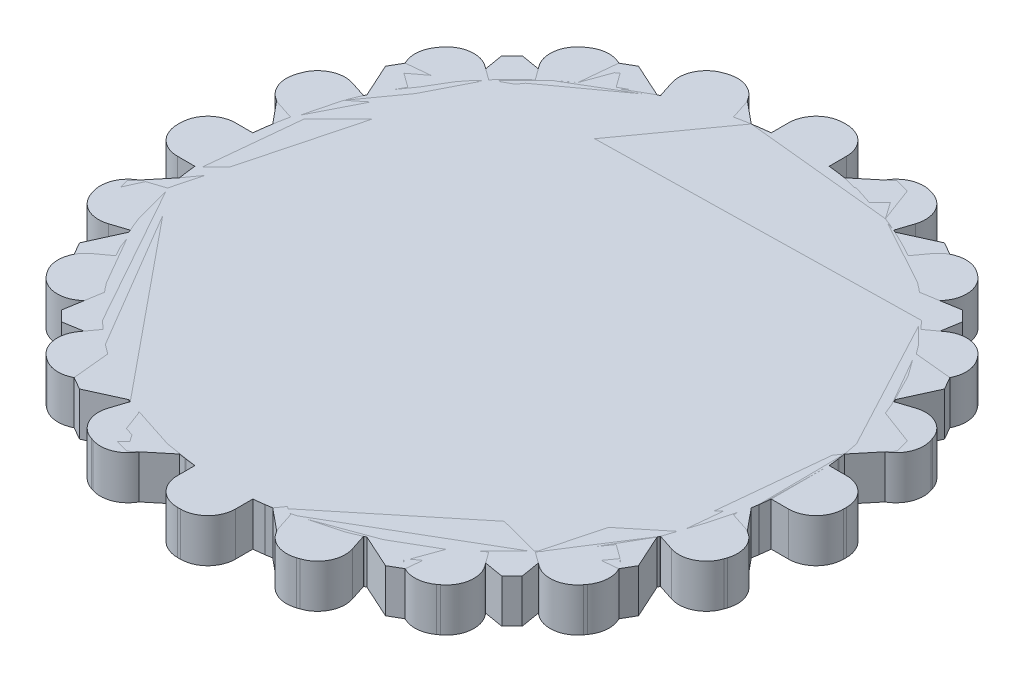
from build123d import *

# Parameters (mm, degrees)
BOSS_EXTRUDE3_DEPTH = 3
BOSS_EXTRUDE5_DEPTH = 3
BOSS_EXTRUDE6_DEPTH = 3


with BuildPart() as part:
    # Sketch2 → Boss-Extrude3 (new body)
    with BuildSketch(Plane(origin=(0, 0, 0), x_dir=(1, 0, 0), z_dir=(0, 1, 0))):
        with BuildLine():
            Line((-23, 0.1), (-23, -0.1))
            ThreePointArc((-23, -0.1), (-22.443502884, -1.443502884), (-21.1, -2))
            Line((-21.1, -2), (-19.899748742, -2))
            ThreePointArc((-19.899748742, -2), (-19.753766812, -3.128689301), (-19.543819703, -4.247247513))
            Line((-19.543819703, -4.247247513), (-20.685326483, -4.618145549))
            ThreePointArc((-20.685326483, -4.618145549), (-21.791106589, -5.56257098), (-21.905201574, -7.012285219))
            Line((-21.905201574, -7.012285219), (-21.843398175, -7.202496522))
            ThreePointArc((-21.843398175, -7.202496522), (-20.898972744, -8.308276629), (-19.449258505, -8.422371614))
            Line((-19.449258505, -8.422371614), (-18.307751725, -8.051473578))
            ThreePointArc((-18.307751725, -8.051473578), (-17.820130484, -9.079809995), (-17.274805421, -10.078744846))
            Line((-17.274805421, -10.078744846), (-18.245829086, -10.784234835))
            ThreePointArc((-18.245829086, -10.784234835), (-19.005644954, -12.02414164), (-18.666169396, -13.438159103))
            Line((-18.666169396, -13.438159103), (-18.548612345, -13.599962502))
            ThreePointArc((-18.548612345, -13.599962502), (-17.30870554, -14.35977837), (-15.894688077, -14.020302812))
            Line((-15.894688077, -14.020302812), (-14.923664412, -13.314812824))
            ThreePointArc((-14.923664412, -13.314812824), (-14.142135624, -14.142135624), (-13.314812824, -14.923664412))
            Line((-13.314812824, -14.923664412), (-14.020302812, -15.894688077))
            ThreePointArc((-14.020302812, -15.894688077), (-14.35977837, -17.30870554), (-13.599962502, -18.548612345))
            Line((-13.599962502, -18.548612345), (-13.438159103, -18.666169396))
            ThreePointArc((-13.438159103, -18.666169396), (-12.02414164, -19.005644954), (-10.784234835, -18.245829086))
            Line((-10.784234835, -18.245829086), (-10.078744846, -17.274805421))
            ThreePointArc((-10.078744846, -17.274805421), (-9.079809995, -17.820130484), (-8.051473578, -18.307751725))
            Line((-8.051473578, -18.307751725), (-8.422371614, -19.449258505))
            ThreePointArc((-8.422371614, -19.449258505), (-8.308276629, -20.898972744), (-7.202496522, -21.843398175))
            Line((-7.202496522, -21.843398175), (-7.012285219, -21.905201574))
            ThreePointArc((-7.012285219, -21.905201574), (-5.56257098, -21.791106589), (-4.618145549, -20.685326483))
            Line((-4.618145549, -20.685326483), (-4.247247513, -19.543819703))
            ThreePointArc((-4.247247513, -19.543819703), (-3.128689301, -19.753766812), (-2, -19.899748742))
            Line((-2, -19.899748742), (-2, -21.1))
            ThreePointArc((-2, -21.1), (-1.443502884, -22.443502884), (-0.1, -23))
            Line((-0.1, -23), (0.1, -23))
            ThreePointArc((0.1, -23), (1.443502884, -22.443502884), (2, -21.1))
            Line((2, -21.1), (2, -19.899748742))
            ThreePointArc((2, -19.899748742), (3.128689301, -19.753766812), (4.247247513, -19.543819703))
            Line((4.247247513, -19.543819703), (4.618145549, -20.685326483))
            ThreePointArc((4.618145549, -20.685326483), (5.56257098, -21.791106589), (7.012285219, -21.905201574))
            Line((7.012285219, -21.905201574), (7.202496522, -21.843398175))
            ThreePointArc((7.202496522, -21.843398175), (8.308276629, -20.898972744), (8.422371614, -19.449258505))
            Line((8.422371614, -19.449258505), (8.051473578, -18.307751725))
            ThreePointArc((8.051473578, -18.307751725), (9.079809995, -17.820130484), (10.078744846, -17.274805421))
            Line((10.078744846, -17.274805421), (10.784234835, -18.245829086))
            ThreePointArc((10.784234835, -18.245829086), (12.02414164, -19.005644954), (13.438159103, -18.666169396))
            Line((13.438159103, -18.666169396), (13.599962502, -18.548612345))
            ThreePointArc((13.599962502, -18.548612345), (14.35977837, -17.30870554), (14.020302812, -15.894688077))
            Line((14.020302812, -15.894688077), (13.314812824, -14.923664412))
            ThreePointArc((13.314812824, -14.923664412), (14.142135624, -14.142135624), (14.923664412, -13.314812824))
            Line((14.923664412, -13.314812824), (15.894688077, -14.020302812))
            ThreePointArc((15.894688077, -14.020302812), (17.30870554, -14.35977837), (18.548612345, -13.599962502))
            Line((18.548612345, -13.599962502), (18.666169396, -13.438159103))
            ThreePointArc((18.666169396, -13.438159103), (19.005644954, -12.02414164), (18.245829086, -10.784234835))
            Line((18.245829086, -10.784234835), (17.274805421, -10.078744846))
            ThreePointArc((17.274805421, -10.078744846), (17.820130484, -9.079809995), (18.307751725, -8.051473578))
            Line((18.307751725, -8.051473578), (19.449258505, -8.422371614))
            ThreePointArc((19.449258505, -8.422371614), (20.898972744, -8.308276629), (21.843398175, -7.202496522))
            Line((21.843398175, -7.202496522), (21.905201574, -7.012285219))
            ThreePointArc((21.905201574, -7.012285219), (21.791106589, -5.56257098), (20.685326483, -4.618145549))
            Line((20.685326483, -4.618145549), (19.543819703, -4.247247513))
            ThreePointArc((19.543819703, -4.247247513), (19.753766812, -3.128689301), (19.899748742, -2))
            Line((19.899748742, -2), (21.1, -2))
            ThreePointArc((21.1, -2), (22.443502884, -1.443502884), (23, -0.1))
            Line((23, -0.1), (23, 0.1))
            ThreePointArc((23, 0.1), (22.443502884, 1.443502884), (21.1, 2))
            Line((21.1, 2), (19.899748742, 2))
            ThreePointArc((19.899748742, 2), (19.753766812, 3.128689301), (19.543819703, 4.247247513))
            Line((19.543819703, 4.247247513), (20.685326483, 4.618145549))
            ThreePointArc((20.685326483, 4.618145549), (21.791106589, 5.56257098), (21.905201574, 7.012285219))
            Line((21.905201574, 7.012285219), (21.843398175, 7.202496522))
            ThreePointArc((21.843398175, 7.202496522), (20.898972744, 8.308276629), (19.449258505, 8.422371614))
            Line((19.449258505, 8.422371614), (18.307751725, 8.051473578))
            ThreePointArc((18.307751725, 8.051473578), (17.820130484, 9.079809995), (17.274805421, 10.078744846))
            Line((17.274805421, 10.078744846), (18.245829086, 10.784234835))
            ThreePointArc((18.245829086, 10.784234835), (19.005644954, 12.02414164), (18.666169396, 13.438159103))
            Line((18.666169396, 13.438159103), (18.548612345, 13.599962502))
            ThreePointArc((18.548612345, 13.599962502), (17.30870554, 14.35977837), (15.894688077, 14.020302812))
            Line((15.894688077, 14.020302812), (14.923664412, 13.314812824))
            ThreePointArc((14.923664412, 13.314812824), (14.142135624, 14.142135624), (13.314812824, 14.923664412))
            Line((13.314812824, 14.923664412), (14.020302812, 15.894688077))
            ThreePointArc((14.020302812, 15.894688077), (14.35977837, 17.30870554), (13.599962502, 18.548612345))
            Line((13.599962502, 18.548612345), (13.438159103, 18.666169396))
            ThreePointArc((13.438159103, 18.666169396), (12.02414164, 19.005644954), (10.784234835, 18.245829086))
            Line((10.784234835, 18.245829086), (10.078744846, 17.274805421))
            ThreePointArc((10.078744846, 17.274805421), (9.079809995, 17.820130484), (8.051473578, 18.307751725))
            Line((8.051473578, 18.307751725), (8.422371614, 19.449258505))
            ThreePointArc((8.422371614, 19.449258505), (8.308276629, 20.898972744), (7.202496522, 21.843398175))
            Line((7.202496522, 21.843398175), (7.012285219, 21.905201574))
            ThreePointArc((7.012285219, 21.905201574), (5.56257098, 21.791106589), (4.618145549, 20.685326483))
            Line((4.618145549, 20.685326483), (4.247247513, 19.543819703))
            ThreePointArc((4.247247513, 19.543819703), (3.128689301, 19.753766812), (2, 19.899748742))
            Line((2, 19.899748742), (2, 21.1))
            ThreePointArc((2, 21.1), (1.443502884, 22.443502884), (0.1, 23))
            Line((0.1, 23), (-0.1, 23))
            ThreePointArc((-0.1, 23), (-1.443502884, 22.443502884), (-2, 21.1))
            Line((-2, 21.1), (-2, 19.899748742))
            ThreePointArc((-2, 19.899748742), (-3.128689301, 19.753766812), (-4.247247513, 19.543819703))
            Line((-4.247247513, 19.543819703), (-4.618145549, 20.685326483))
            ThreePointArc((-4.618145549, 20.685326483), (-5.56257098, 21.791106589), (-7.012285219, 21.905201574))
            Line((-7.012285219, 21.905201574), (-7.202496522, 21.843398175))
            ThreePointArc((-7.202496522, 21.843398175), (-8.308276629, 20.898972744), (-8.422371614, 19.449258505))
            Line((-8.422371614, 19.449258505), (-8.051473578, 18.307751725))
            ThreePointArc((-8.051473578, 18.307751725), (-9.079809995, 17.820130484), (-10.078744846, 17.274805421))
            Line((-10.078744846, 17.274805421), (-10.784234835, 18.245829086))
            ThreePointArc((-10.784234835, 18.245829086), (-12.02414164, 19.005644954), (-13.438159103, 18.666169396))
            Line((-13.438159103, 18.666169396), (-13.599962502, 18.548612345))
            ThreePointArc((-13.599962502, 18.548612345), (-14.35977837, 17.30870554), (-14.020302812, 15.894688077))
            Line((-14.020302812, 15.894688077), (-13.314812824, 14.923664412))
            ThreePointArc((-13.314812824, 14.923664412), (-14.142135624, 14.142135624), (-14.923664412, 13.314812824))
            Line((-14.923664412, 13.314812824), (-15.894688077, 14.020302812))
            ThreePointArc((-15.894688077, 14.020302812), (-17.30870554, 14.35977837), (-18.548612345, 13.599962502))
            Line((-18.548612345, 13.599962502), (-18.666169396, 13.438159103))
            ThreePointArc((-18.666169396, 13.438159103), (-19.005644954, 12.02414164), (-18.245829086, 10.784234835))
            Line((-18.245829086, 10.784234835), (-17.274805421, 10.078744846))
            ThreePointArc((-17.274805421, 10.078744846), (-17.820130484, 9.079809995), (-18.307751725, 8.051473578))
            Line((-18.307751725, 8.051473578), (-19.449258505, 8.422371614))
            ThreePointArc((-19.449258505, 8.422371614), (-20.898972744, 8.308276629), (-21.843398175, 7.202496522))
            Line((-21.843398175, 7.202496522), (-21.905201574, 7.012285219))
            ThreePointArc((-21.905201574, 7.012285219), (-21.791106589, 5.56257098), (-20.685326483, 4.618145549))
            Line((-20.685326483, 4.618145549), (-19.543819703, 4.247247513))
            ThreePointArc((-19.543819703, 4.247247513), (-19.753766812, 3.128689301), (-19.899748742, 2))
            Line((-19.899748742, 2), (-21.1, 2))
            ThreePointArc((-21.1, 2), (-22.443502884, 1.443502884), (-23, 0.1))
        make_face()
    extrude(amount=BOSS_EXTRUDE3_DEPTH)


with BuildPart() as body_2:
    # Sketch3 → Boss-Extrude5 (new body)
    with BuildSketch(Plane(origin=(0, 0, 0), x_dir=(1, 0, 0), z_dir=(0, 1, 0))):
        with BuildLine():
            Line((-22, 0.5), (-22, -0.5))
            Line((-22, -0.5), (-19.899748742, -2))
            ThreePointArc((-19.899748742, -2), (-19.828897227, -2.610523844), (-19.739319337, -3.218582315))
            Line((-19.739319337, -3.218582315), (-21.379777701, -5.211056079))
            Line((-21.379777701, -5.211056079), (-21.120958656, -6.176981905))
            Line((-21.120958656, -6.176981905), (-18.704043156, -7.08228562))
            ThreePointArc((-18.704043156, -7.08228562), (-18.47759065, -7.653668647), (-18.23368794, -8.217823563))
            Line((-18.23368794, -8.217823563), (-19.302558883, -10.566987298))
            Line((-19.302558883, -10.566987298), (-18.802558883, -11.433012702))
            Line((-18.802558883, -11.433012702), (-16.23368794, -11.681925179))
            ThreePointArc((-16.23368794, -11.681925179), (-15.867066806, -12.17522858), (-15.485460842, -12.657033717))
            Line((-15.485460842, -12.657033717), (-15.909902577, -15.202795796))
            Line((-15.909902577, -15.202795796), (-15.202795796, -15.909902577))
            Line((-15.202795796, -15.909902577), (-12.657033717, -15.485460842))
            ThreePointArc((-12.657033717, -15.485460842), (-12.17522858, -15.867066806), (-11.681925179, -16.23368794))
            Line((-11.681925179, -16.23368794), (-11.433012702, -18.802558883))
            Line((-11.433012702, -18.802558883), (-10.566987298, -19.302558883))
            Line((-10.566987298, -19.302558883), (-8.217823563, -18.23368794))
            ThreePointArc((-8.217823563, -18.23368794), (-7.653668647, -18.47759065), (-7.08228562, -18.704043156))
            Line((-7.08228562, -18.704043156), (-6.176981905, -21.120958656))
            Line((-6.176981905, -21.120958656), (-5.211056079, -21.379777701))
            Line((-5.211056079, -21.379777701), (-3.218582315, -19.739319337))
            ThreePointArc((-3.218582315, -19.739319337), (-2.610523844, -19.828897227), (-2, -19.899748742))
            Line((-2, -19.899748742), (-0.5, -22))
            Line((-0.5, -22), (0.5, -22))
            Line((0.5, -22), (2, -19.899748742))
            ThreePointArc((2, -19.899748742), (2.610523844, -19.828897227), (3.218582315, -19.739319337))
            Line((3.218582315, -19.739319337), (5.211056079, -21.379777701))
            Line((5.211056079, -21.379777701), (6.176981905, -21.120958656))
            Line((6.176981905, -21.120958656), (7.08228562, -18.704043156))
            ThreePointArc((7.08228562, -18.704043156), (7.653668647, -18.47759065), (8.217823563, -18.23368794))
            Line((8.217823563, -18.23368794), (10.566987298, -19.302558883))
            Line((10.566987298, -19.302558883), (11.433012702, -18.802558883))
            Line((11.433012702, -18.802558883), (11.681925179, -16.23368794))
            ThreePointArc((11.681925179, -16.23368794), (12.17522858, -15.867066806), (12.657033717, -15.485460842))
            Line((12.657033717, -15.485460842), (15.202795796, -15.909902577))
            Line((15.202795796, -15.909902577), (15.909902577, -15.202795796))
            Line((15.909902577, -15.202795796), (15.485460842, -12.657033717))
            ThreePointArc((15.485460842, -12.657033717), (15.867066806, -12.17522858), (16.23368794, -11.681925179))
            Line((16.23368794, -11.681925179), (18.802558883, -11.433012702))
            Line((18.802558883, -11.433012702), (19.302558883, -10.566987298))
            Line((19.302558883, -10.566987298), (18.23368794, -8.217823563))
            ThreePointArc((18.23368794, -8.217823563), (18.47759065, -7.653668647), (18.704043156, -7.08228562))
            Line((18.704043156, -7.08228562), (21.120958656, -6.176981905))
            Line((21.120958656, -6.176981905), (21.379777701, -5.211056079))
            Line((21.379777701, -5.211056079), (19.739319337, -3.218582315))
            ThreePointArc((19.739319337, -3.218582315), (19.828897227, -2.610523844), (19.899748742, -2))
            Line((19.899748742, -2), (22, -0.5))
            Line((22, -0.5), (22, 0.5))
            Line((22, 0.5), (19.899748742, 2))
            ThreePointArc((19.899748742, 2), (19.828897227, 2.610523844), (19.739319337, 3.218582315))
            Line((19.739319337, 3.218582315), (21.379777701, 5.211056079))
            Line((21.379777701, 5.211056079), (21.120958656, 6.176981905))
            Line((21.120958656, 6.176981905), (18.704043156, 7.08228562))
            ThreePointArc((18.704043156, 7.08228562), (18.47759065, 7.653668647), (18.23368794, 8.217823563))
            Line((18.23368794, 8.217823563), (19.302558883, 10.566987298))
            Line((19.302558883, 10.566987298), (18.802558883, 11.433012702))
            Line((18.802558883, 11.433012702), (16.23368794, 11.681925179))
            ThreePointArc((16.23368794, 11.681925179), (15.867066806, 12.17522858), (15.485460842, 12.657033717))
            Line((15.485460842, 12.657033717), (15.909902577, 15.202795796))
            Line((15.909902577, 15.202795796), (15.202795796, 15.909902577))
            Line((15.202795796, 15.909902577), (12.657033717, 15.485460842))
            ThreePointArc((12.657033717, 15.485460842), (12.17522858, 15.867066806), (11.681925179, 16.23368794))
            Line((11.681925179, 16.23368794), (11.433012702, 18.802558883))
            Line((11.433012702, 18.802558883), (10.566987298, 19.302558883))
            Line((10.566987298, 19.302558883), (8.217823563, 18.23368794))
            ThreePointArc((8.217823563, 18.23368794), (7.653668647, 18.47759065), (7.08228562, 18.704043156))
            Line((7.08228562, 18.704043156), (6.176981905, 21.120958656))
            Line((6.176981905, 21.120958656), (5.211056079, 21.379777701))
            Line((5.211056079, 21.379777701), (3.218582315, 19.739319337))
            ThreePointArc((3.218582315, 19.739319337), (2.610523844, 19.828897227), (2, 19.899748742))
            Line((2, 19.899748742), (0.5, 22))
            Line((0.5, 22), (-0.5, 22))
            Line((-0.5, 22), (-2, 19.899748742))
            ThreePointArc((-2, 19.899748742), (-2.610523844, 19.828897227), (-3.218582315, 19.739319337))
            Line((-3.218582315, 19.739319337), (-5.211056079, 21.379777701))
            Line((-5.211056079, 21.379777701), (-6.176981905, 21.120958656))
            Line((-6.176981905, 21.120958656), (-7.08228562, 18.704043156))
            ThreePointArc((-7.08228562, 18.704043156), (-7.653668647, 18.47759065), (-8.217823563, 18.23368794))
            Line((-8.217823563, 18.23368794), (-10.566987298, 19.302558883))
            Line((-10.566987298, 19.302558883), (-11.433012702, 18.802558883))
            Line((-11.433012702, 18.802558883), (-11.681925179, 16.23368794))
            ThreePointArc((-11.681925179, 16.23368794), (-12.17522858, 15.867066806), (-12.657033717, 15.485460842))
            Line((-12.657033717, 15.485460842), (-15.202795796, 15.909902577))
            Line((-15.202795796, 15.909902577), (-15.909902577, 15.202795796))
            Line((-15.909902577, 15.202795796), (-15.485460842, 12.657033717))
            ThreePointArc((-15.485460842, 12.657033717), (-15.867066806, 12.17522858), (-16.23368794, 11.681925179))
            Line((-16.23368794, 11.681925179), (-18.802558883, 11.433012702))
            Line((-18.802558883, 11.433012702), (-19.302558883, 10.566987298))
            Line((-19.302558883, 10.566987298), (-18.23368794, 8.217823563))
            ThreePointArc((-18.23368794, 8.217823563), (-18.47759065, 7.653668647), (-18.704043156, 7.08228562))
            Line((-18.704043156, 7.08228562), (-21.120958656, 6.176981905))
            Line((-21.120958656, 6.176981905), (-21.379777701, 5.211056079))
            Line((-21.379777701, 5.211056079), (-19.739319337, 3.218582315))
            ThreePointArc((-19.739319337, 3.218582315), (-19.828897227, 2.610523844), (-19.899748742, 2))
            Line((-19.899748742, 2), (-22, 0.5))
        make_face()
    extrude(amount=BOSS_EXTRUDE5_DEPTH)


with BuildPart() as body_3:
    # Sketch1 → Boss-Extrude6 (new body)
    with BuildSketch(Plane(origin=(0, 0, 0), x_dir=(1, 0, 0), z_dir=(0, 1, 0))):
        with BuildLine():
            Line((-0.5, 14.746169466), (0.5, 14.746169466))
            Line((0.5, 14.746169466), (2, 12.544128437))
            ThreePointArc((2, 12.544128437), (2.588190451, 12.405427729), (3.166928678, 12.23145084))
            Line((3.166928678, 12.23145084), (5.566987298, 13.388474311))
            Line((5.566987298, 13.388474311), (6.433012702, 12.888474311))
            Line((6.433012702, 12.888474311), (6.631030293, 10.23145084))
            ThreePointArc((6.631030293, 10.23145084), (7.071067812, 9.817237278), (7.485281374, 9.377199759))
            Line((7.485281374, 9.377199759), (10.142304845, 9.179182168))
            Line((10.142304845, 9.179182168), (10.642304845, 8.313156764))
            Line((10.642304845, 8.313156764), (9.485281374, 5.913098144))
            ThreePointArc((9.485281374, 5.913098144), (9.659258263, 5.334359917), (9.797958971, 4.746169466))
            Line((9.797958971, 4.746169466), (12, 3.246169466))
            Line((12, 3.246169466), (12, 2.246169466))
            Line((12, 2.246169466), (9.797958971, 0.746169466))
            ThreePointArc((9.797958971, 0.746169466), (9.659258263, 0.157979015), (9.485281374, -0.420759212))
            Line((9.485281374, -0.420759212), (10.642304845, -2.820817832))
            Line((10.642304845, -2.820817832), (10.142304845, -3.686843236))
            Line((10.142304845, -3.686843236), (7.485281374, -3.884860827))
            ThreePointArc((7.485281374, -3.884860827), (7.071067812, -4.324898346), (6.631030293, -4.739111908))
            Line((6.631030293, -4.739111908), (6.433012702, -7.39613538))
            Line((6.433012702, -7.39613538), (5.566987298, -7.89613538))
            Line((5.566987298, -7.89613538), (3.166928678, -6.739111908))
            ThreePointArc((3.166928678, -6.739111908), (2.588190451, -6.913088797), (2, -7.051789505))
            Line((2, -7.051789505), (0.5, -9.253830534))
            Line((0.5, -9.253830534), (-0.5, -9.253830534))
            Line((-0.5, -9.253830534), (-2, -7.051789505))
            ThreePointArc((-2, -7.051789505), (-2.588190451, -6.913088797), (-3.166928678, -6.739111908))
            Line((-3.166928678, -6.739111908), (-5.566987298, -7.89613538))
            Line((-5.566987298, -7.89613538), (-6.433012702, -7.39613538))
            Line((-6.433012702, -7.39613538), (-6.631030293, -4.739111908))
            ThreePointArc((-6.631030293, -4.739111908), (-7.071067812, -4.324898346), (-7.485281374, -3.884860827))
            Line((-7.485281374, -3.884860827), (-10.142304845, -3.686843236))
            Line((-10.142304845, -3.686843236), (-10.642304845, -2.820817832))
            Line((-10.642304845, -2.820817832), (-9.485281374, -0.420759212))
            ThreePointArc((-9.485281374, -0.420759212), (-9.659258263, 0.157979015), (-9.797958971, 0.746169466))
            Line((-9.797958971, 0.746169466), (-12, 2.246169466))
            Line((-12, 2.246169466), (-12, 3.246169466))
            Line((-12, 3.246169466), (-9.797958971, 4.746169466))
            ThreePointArc((-9.797958971, 4.746169466), (-9.659258263, 5.334359917), (-9.485281374, 5.913098144))
            Line((-9.485281374, 5.913098144), (-10.642304845, 8.313156764))
            Line((-10.642304845, 8.313156764), (-10.142304845, 9.179182168))
            Line((-10.142304845, 9.179182168), (-7.485281374, 9.377199759))
            ThreePointArc((-7.485281374, 9.377199759), (-7.071067812, 9.817237278), (-6.631030293, 10.23145084))
            Line((-6.631030293, 10.23145084), (-6.433012702, 12.888474311))
            Line((-6.433012702, 12.888474311), (-5.566987298, 13.388474311))
            Line((-5.566987298, 13.388474311), (-3.166928678, 12.23145084))
            ThreePointArc((-3.166928678, 12.23145084), (-2.588190451, 12.405427729), (-2, 12.544128437))
            Line((-2, 12.544128437), (-0.5, 14.746169466))
        make_face()
    extrude(amount=BOSS_EXTRUDE6_DEPTH)


solid = Compound([part.part, body_2.part, body_3.part])
